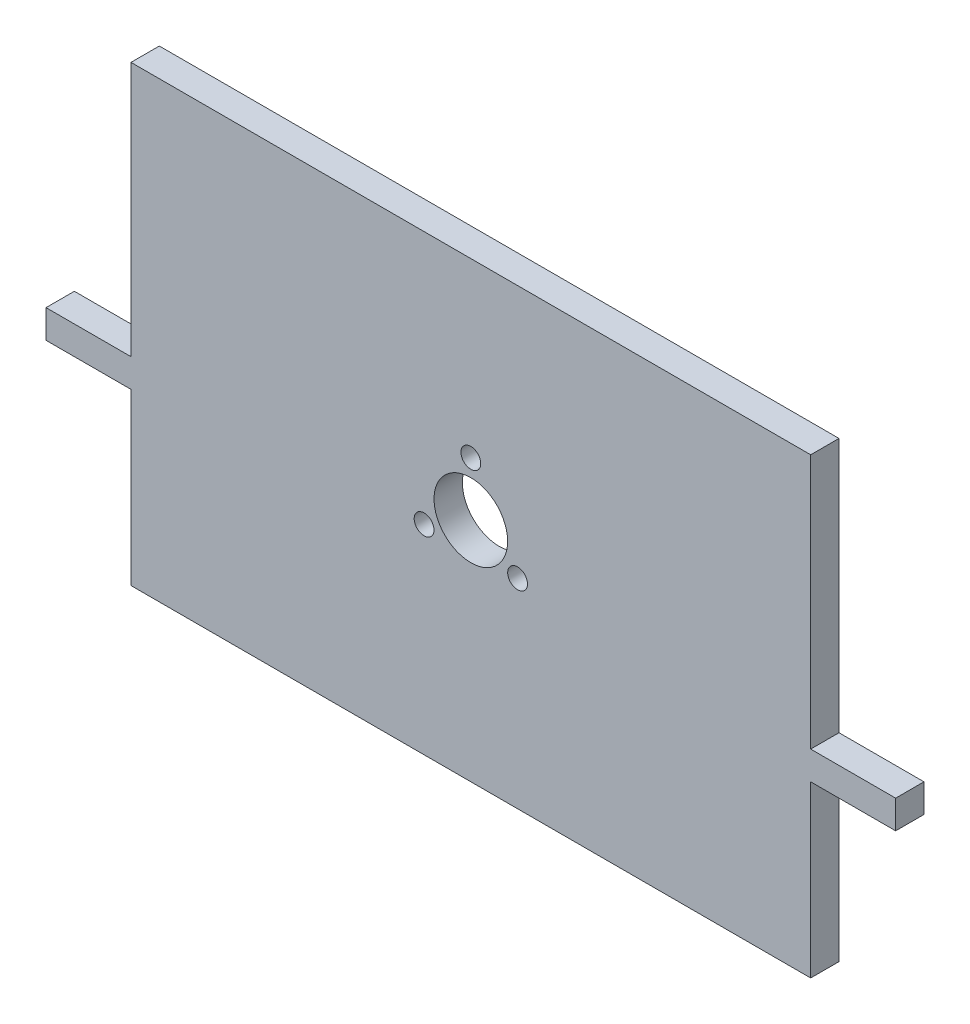
from build123d import *

# Parameters (mm, degrees)
SKETCH_1_W          = 120
SKETCH_1_H          = 90
EXTRUDE_1_DEPTH     = 5
SKETCH_5_W          = 120
SKETCH_5_H          = 10
CUT_EXTRUDE_3_DEPTH = 10
SKETCH_10_W         = 5
SKETCH_10_H         = 5.002587902
EXTRUDE_3_DEPTH     = 15
SKETCH_12_W         = 5
SKETCH_12_H         = 5.002587902
EXTRUDE_4_DEPTH     = 15
SKETCH_13_R         = 6.5
SKETCH_13_R_2       = 1.75
CUT_EXTRUDE_4_DEPTH = 15


with BuildPart() as part:
    # 草图1 → 凸台-拉伸1 (new body)
    with BuildSketch(Plane.XY):
        Rectangle(SKETCH_1_W, SKETCH_1_H)
    extrude(amount=EXTRUDE_1_DEPTH)

    # 草图5 → 切除-拉伸3 (cut)
    with BuildSketch(Plane(origin=(0, 0, 0), x_dir=(-1, 0, 0), z_dir=(0, 0, -1))):
        with Locations((0, -40)):
            Rectangle(SKETCH_5_W, SKETCH_5_H)
    extrude(amount=-CUT_EXTRUDE_3_DEPTH, mode=Mode.SUBTRACT)

    # 草图10 → 凸台-拉伸3 (add)
    with BuildSketch(Plane(origin=(60, 0, 0), x_dir=(0, 0, -1), z_dir=(1, 0, 0))):
        with Locations((-2.5, -2.501293951)):
            Rectangle(SKETCH_10_W, SKETCH_10_H)
    extrude(amount=EXTRUDE_3_DEPTH)

    # 草图12 → 凸台-拉伸4 (add)
    with BuildSketch(Plane.ZY.offset(60)):
        with Locations((2.5, -2.501293951)):
            Rectangle(SKETCH_12_W, SKETCH_12_H)
    extrude(amount=EXTRUDE_4_DEPTH)

    # 草图13 → 切除-拉伸4 (cut)
    with BuildSketch(Plane.XY.offset(5)):
        with Locations((0, 5)):
            Circle(SKETCH_13_R)
        with Locations((8.253222098, 0.235)):
            Circle(SKETCH_13_R_2)
        with Locations((-8.253222098, 0.235)):
            Circle(SKETCH_13_R_2)
        with Locations((0, 14.53)):
            Circle(SKETCH_13_R_2)
    extrude(amount=-CUT_EXTRUDE_4_DEPTH, mode=Mode.SUBTRACT)


solid = part.part
